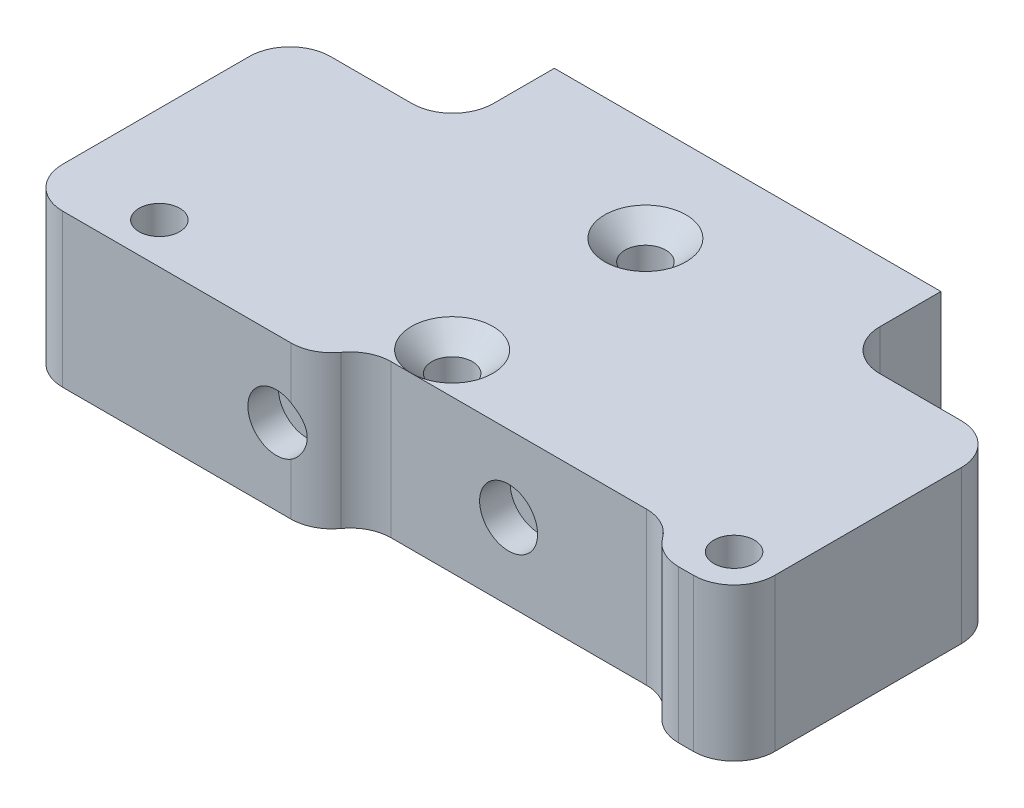
from build123d import *

# Parameters (mm, degrees)
SKETCH1_W           = 70
SKETCH1_H           = 34
SKETCH1_R           = 2
BOSS_EXTRUDE1_DEPTH = 15
SKETCH6_W           = 70
SKETCH6_H           = 15
BOSS_EXTRUDE2_DEPTH = 5
SKETCH3_R           = 2
CUT_EXTRUDE2_DEPTH  = 15
SKETCH8_W           = 6
SKETCH8_H           = 5
CUT_EXTRUDE3_DEPTH  = 15
SKETCH9_W           = 12
SKETCH9_H           = 6
CUT_EXTRUDE4_DEPTH  = 15
SKETCH10_W          = 16
SKETCH10_H          = 10
CUT_EXTRUDE5_DEPTH  = 17
SKETCH12_R          = 1.5
CUT_EXTRUDE6_DEPTH  = 41
SKETCH13_W          = 27.5
SKETCH13_H          = 6
CUT_EXTRUDE7_DEPTH  = 20
SKETCH14_W          = 13.5
SKETCH14_H          = 2.67
SKETCH14_W_2        = 29
CUT_EXTRUDE8_DEPTH  = 17
FILLET2_R           = 4
SKETCH16_W          = 5.5
SKETCH16_H          = 3.33
CUT_EXTRUDE10_DEPTH = 18
FILLET4_R           = 4
FILLET5_R           = 4
SKETCH17_R          = 2.85
CUT_EXTRUDE11_DEPTH = 3
SKETCH18_R          = 2.8
CUT_EXTRUDE12_DEPTH = 3
CHAMFER1_SIZE       = 2


# Some blends are built 0.0001 mm under size
with BuildPart() as part:
    # Sketch1 → Boss-Extrude1 (new body)
    with BuildSketch(Plane(origin=(0, 0, 0), x_dir=(1, 0, 0), z_dir=(0, 1, 0))):
        with Locations((-35, 17)):
            Rectangle(SKETCH1_W, SKETCH1_H)
        with Locations(Location((-35.05, 24, 0), (0, 0, 270))):
            Circle(SKETCH1_R, mode=Mode.SUBTRACT)
        with Locations(Location((-35.05, 5, 0), (0, 0, 270))):
            Circle(SKETCH1_R, mode=Mode.SUBTRACT)
    extrude(amount=BOSS_EXTRUDE1_DEPTH)

    # Sketch6 → Boss-Extrude2 (add)
    with BuildSketch(Plane.XY):
        with Locations((-35, 7.5)):
            Rectangle(SKETCH6_W, SKETCH6_H)
    extrude(amount=BOSS_EXTRUDE2_DEPTH)

    # Sketch3 → Cut-Extrude2 (cut)
    with BuildSketch(Plane(origin=(0, 15, 0), x_dir=(1, 0, 0), z_dir=(0, 1, 0))):
        with Locations(Location((-4, 1.67, 0), (0, 0, 270))):
            Circle(SKETCH3_R)
        with Locations(Location((-60.5, 1.67, 0), (0, 0, 270))):
            Circle(SKETCH3_R)
    extrude(amount=-CUT_EXTRUDE2_DEPTH, mode=Mode.SUBTRACT)

    # Sketch8 → Cut-Extrude3 (cut)
    with BuildSketch(Plane(origin=(0, 15, 0), x_dir=(1, 0, 0), z_dir=(0, 1, 0))):
        with Locations((-16.5, -2.5)):
            Rectangle(SKETCH8_W, SKETCH8_H)
    extrude(amount=-CUT_EXTRUDE3_DEPTH, mode=Mode.SUBTRACT)

    # Sketch9 → Cut-Extrude4 (cut)
    with BuildSketch(Plane(origin=(0, 15, 0), x_dir=(1, 0, 0), z_dir=(0, 1, 0))):
        with Locations((-35, -2)):
            Rectangle(SKETCH9_W, SKETCH9_H)
    extrude(amount=-CUT_EXTRUDE4_DEPTH, mode=Mode.SUBTRACT)

    # Sketch10 → Cut-Extrude5 (cut)
    with BuildSketch(Plane.XZ):
        with Locations((-8, -29)):
            Rectangle(SKETCH10_W, SKETCH10_H)
        with Locations((-62, -29)):
            Rectangle(SKETCH10_W, SKETCH10_H)
    extrude(amount=-CUT_EXTRUDE5_DEPTH, mode=Mode.SUBTRACT)

    # Sketch12 → Cut-Extrude6 (cut)
    with BuildSketch(Plane.XY.offset(5)):
        with Locations((-44.5, 7.5)):
            Circle(SKETCH12_R)
        with Locations((-25, 7.499999999)):
            Circle(SKETCH12_R)
    extrude(amount=-CUT_EXTRUDE6_DEPTH, mode=Mode.SUBTRACT)

    # Sketch13 → Cut-Extrude7 (cut)
    with BuildSketch(Plane(origin=(0, 15, 0), x_dir=(1, 0, 0), z_dir=(0, 1, 0))):
        with Locations((-27.25, -2)):
            Rectangle(SKETCH13_W, SKETCH13_H)
    extrude(amount=-CUT_EXTRUDE7_DEPTH, mode=Mode.SUBTRACT)

    # Sketch14 → Cut-Extrude8 (cut)
    with BuildSketch(Plane(origin=(0, 0, 0), x_dir=(-1, 0, 0), z_dir=(0, -1, 0))):
        with Locations((6.75, -3.665)):
            Rectangle(SKETCH14_W, SKETCH14_H)
        with Locations((55.5, -3.665)):
            Rectangle(SKETCH14_W_2, SKETCH14_H)
    extrude(amount=-CUT_EXTRUDE8_DEPTH, mode=Mode.SUBTRACT)

    # Fillet2
    fillet2_edges = [part.edges().sort_by_distance(p)[0] for p in [
        (0, 7.5, 2.33),
        (-70, 7.5, 2.33),
        (-70, 7.5, -24),
        (0, 7.5, -24),
    ]]
    fillet(fillet2_edges, radius=FILLET2_R)

    # Sketch16 → Cut-Extrude10 (cut)
    with BuildSketch(Plane.XZ):
        with Locations((-10.75, 0.665)):
            Rectangle(SKETCH16_W, SKETCH16_H)
    extrude(amount=-CUT_EXTRUDE10_DEPTH, mode=Mode.SUBTRACT)

    # Fillet4
    # the kernel refuses this fillet: 4 mm, written as the material it adds along each edge
    with BuildSketch(Plane(origin=(-16, 0, -24), x_dir=(1, 0, 0), z_dir=(0, 1, 0)), Plane(origin=(-54, 0, -24), x_dir=(0, 0, -1), z_dir=(0, 1, 0))) as fillet4_piece_1:
        with BuildLine():
            CenterArc((FILLET4_R, FILLET4_R), FILLET4_R, 180, 90)
            Line((0, FILLET4_R), (-FILLET4_R * 0.02, FILLET4_R))
            Line((-FILLET4_R * 0.02, FILLET4_R), (-FILLET4_R * 0.02, -FILLET4_R * 0.02))
            Line((-FILLET4_R * 0.02, -FILLET4_R * 0.02), (FILLET4_R, -FILLET4_R * 0.02))
            Line((FILLET4_R, -FILLET4_R * 0.02), (FILLET4_R, 0))
        make_face()
    extrude(amount=15)
    with BuildSketch(Plane(origin=(-41, 15, -1), x_dir=(0, 0, 1), z_dir=(0, -1, 0))) as fillet4_piece_2:
        with BuildLine():
            CenterArc((4, -3.943488304), FILLET4_R, 99.642495459, 80.357504541)
            Line((0, -3.943488304), (-0.08, -3.943488304))
            Line((-0.08, -3.943488304), (-0.08, 0))
            Line((-0.08, 0), (0, 0.08))
            ThreePointArc((0, 0.08), (1.665, 0.08), (3.3166, 0.078869766))
            Line((3.3166, 0.078869766), (3.33, 0))
        make_face()
    extrude(amount=15)
    with BuildSketch(Plane(origin=(-8, 0, -1), x_dir=(-1.0, 0, -8.691057696161095e-11), z_dir=(0, 1, 0))) as fillet4_piece_3:
        with BuildLine():
            CenterArc((3.943488303, 4), FILLET4_R, 189.642495464, 80.357504541)
            Line((0, 3.33), (-0.078869766, 3.3166))
            ThreePointArc((-0.078869766, 3.3166), (-0.08, 1.665), (-0.08, 0))
            Line((-0.08, 0), (0, -0.08))
            Line((0, -0.08), (3.943488304, -0.08))
            Line((3.943488304, -0.08), (3.943488304, 0))
        make_face()
    extrude(amount=15)

    # Fillet5
    # the kernel refuses this fillet: 4 mm, written as the material it takes off along each edge
    with BuildSketch(Plane(origin=(-41, -6.379948368, 2.33), x_dir=(0.3855616700587326, 0, -0.922682067985241), z_dir=(0, 1, 0))) as fillet5_piece_1:
        with BuildLine():
            CenterArc((2.706782853, 3.896912262), FILLET5_R, 202.67861385, 54.285267758)
            Line((-0.983945419, 2.354665582), (0, 0))
            ThreePointArc((0, 0), (0.902260951, 0.103087738), (1.804521902, 0))
        make_face()
    extrude(amount=27.759896736, mode=Mode.SUBTRACT)
    with BuildSketch(Plane(origin=(-8, -6.379948368, 2.33), x_dir=(-0.38556167005872005, 0, -0.9226820679852463), z_dir=(0, 1, 0))) as fillet5_piece_2:
        with BuildLine():
            CenterArc((2.706782853, -3.896912262), FILLET5_R, 103.036118392, 54.285267758)
            Line((-0.983945419, -2.354665582), (0, 0))
            ThreePointArc((0, 0), (0.902260951, -0.103087738), (1.804521902, 0))
        make_face()
    extrude(amount=27.759896736, mode=Mode.SUBTRACT)

    # Sketch17 → Cut-Extrude11 (cut)
    with BuildSketch(Plane.XY.offset(-1)):
        with Locations((-25.499999999, 7.499999999)):
            Circle(SKETCH17_R)
    extrude(amount=-CUT_EXTRUDE11_DEPTH, mode=Mode.SUBTRACT)

    # Sketch18 → Cut-Extrude12 (cut)
    with BuildSketch(Plane.XY.offset(2.33)):
        with Locations((-45, 7.5)):
            Circle(SKETCH18_R)
    extrude(amount=-CUT_EXTRUDE12_DEPTH, mode=Mode.SUBTRACT)

    # Chamfer1
    chamfer1_edges = [part.edges().sort_by_distance(p)[0] for p in [
        (-35.05, 0, -26),
        (-35.05, 15, -26),
        (-35.05, 15, -7),
    ]]
    chamfer(chamfer1_edges, length=CHAMFER1_SIZE - 0.0001)  # a hair under: the kernel refuses the full size


solid = part.part
